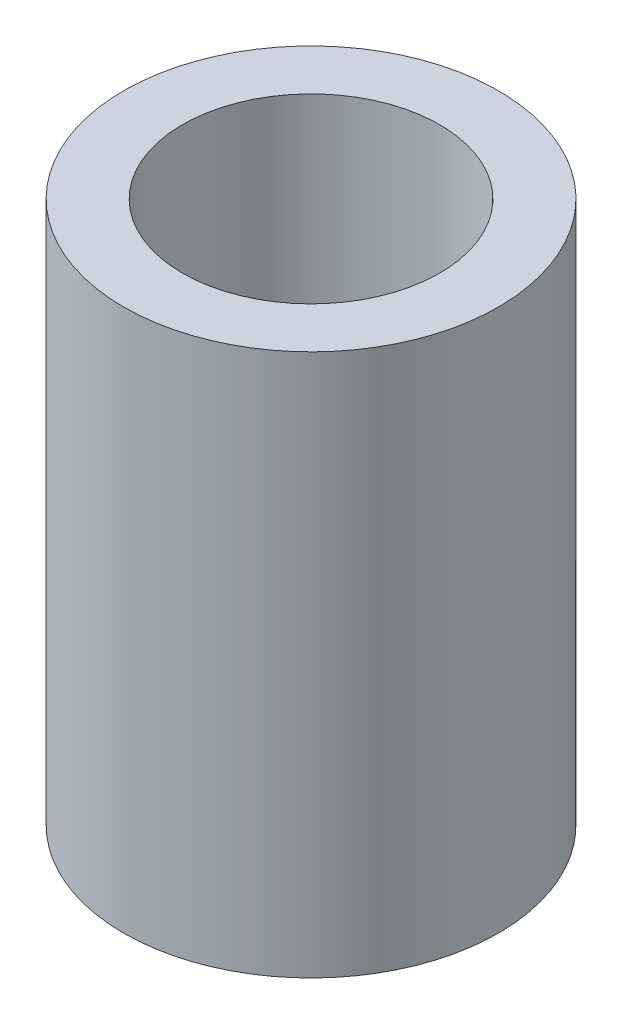
from build123d import *

# Parameters (mm, degrees)
SKETCH1_R           = 8.775
SKETCH1_R_2         = 6.025
BOSS_EXTRUDE1_DEPTH = 25.4


with BuildPart() as part:
    # Sketch1 → Boss-Extrude1 (new body)
    with BuildSketch(Plane(origin=(0, 0, 0), x_dir=(1, 0, 0), z_dir=(0, 1, 0))):
        Circle(SKETCH1_R)
        Circle(SKETCH1_R_2, mode=Mode.SUBTRACT)
    extrude(amount=BOSS_EXTRUDE1_DEPTH)


solid = part.part
